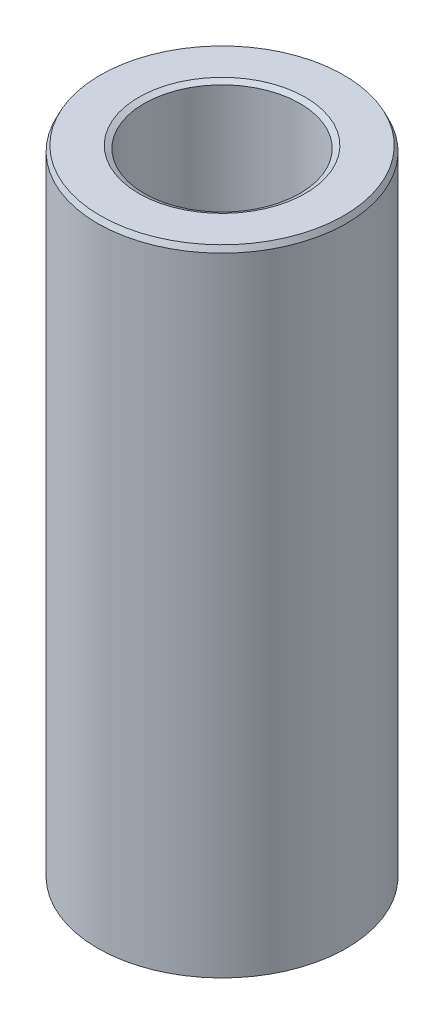
from build123d import *
from OCP.BRepFilletAPI import BRepFilletAPI_MakeChamfer

# Parameters (mm, degrees)
SKETCH1_R           = 32.5
BOSS_EXTRUDE1_DEPTH = 166.04396078
SKETCH2_R           = 20.354437642
CUT_EXTRUDE1_DEPTH  = 173.287831582
CHAMFER1_SIZE       = 1.412049696
CHAMFER1_SIZE2      = 0.69852104


with BuildPart() as part:
    # Sketch1 → Boss-Extrude1 (new body)
    with BuildSketch(Plane(origin=(0, 0, 0), x_dir=(1, 0, 0), z_dir=(0, 1, 0))):
        Circle(SKETCH1_R)
    extrude(amount=BOSS_EXTRUDE1_DEPTH)

    # Sketch2 → Cut-Extrude1 (cut, through all)
    with BuildSketch(Plane(origin=(0, 0, 0), x_dir=(1, 0, 0), z_dir=(0, 1, 0))):
        Circle(SKETCH2_R)
    extrude(amount=CUT_EXTRUDE1_DEPTH, mode=Mode.SUBTRACT)

    # Chamfer1: one chamfer whose edges measure the first distance from different faces: ONE call of the kernel's chamfer builder (chamfer() names one face for all edges)
    chamfer1_edges_1 = [part.edges().sort_by_distance(p)[0] for p in [
        (-20.354437642, 166.04396078, 0),
    ]]
    chamfer1_side_1 = [part.faces().sort_by_distance(p)[0] for p in [
        (-31.580761184, 166.04396078, 0),
    ]]
    chamfer1_edges_2 = [part.edges().sort_by_distance(p)[0] for p in [
        (-20.354437642, 0, 0),
    ]]
    chamfer1_side_2 = [part.faces().sort_by_distance(p)[0] for p in [
        (-20.354437642, 83.02198039, 0),
    ]]
    chamfer1_edges_3 = [part.edges().sort_by_distance(p)[0] for p in [
        (-32.5, 0, 0),
    ]]
    chamfer1_side_3 = [part.faces().sort_by_distance(p)[0] for p in [
        (-31.580761184, 0, 0),
    ]]
    chamfer1_edges_4 = [part.edges().sort_by_distance(p)[0] for p in [
        (-32.5, 166.04396078, 0),
    ]]
    chamfer1_side_4 = [part.faces().sort_by_distance(p)[0] for p in [
        (-32.5, 83.02198039, 0),
    ]]
    chamfer1 = BRepFilletAPI_MakeChamfer(part.part.solid().wrapped)
    for e in chamfer1_edges_1:
        chamfer1.Add(CHAMFER1_SIZE, CHAMFER1_SIZE2, e.wrapped, chamfer1_side_1[0].wrapped)  # the first distance lies on this face
    for e in chamfer1_edges_2:
        chamfer1.Add(CHAMFER1_SIZE, CHAMFER1_SIZE2, e.wrapped, chamfer1_side_2[0].wrapped)  # the first distance lies on this face
    for e in chamfer1_edges_3:
        chamfer1.Add(CHAMFER1_SIZE, CHAMFER1_SIZE2, e.wrapped, chamfer1_side_3[0].wrapped)  # the first distance lies on this face
    for e in chamfer1_edges_4:
        chamfer1.Add(CHAMFER1_SIZE, CHAMFER1_SIZE2, e.wrapped, chamfer1_side_4[0].wrapped)  # the first distance lies on this face
    add(Compound.cast(chamfer1.Shape()), mode=Mode.REPLACE)


solid = part.part
